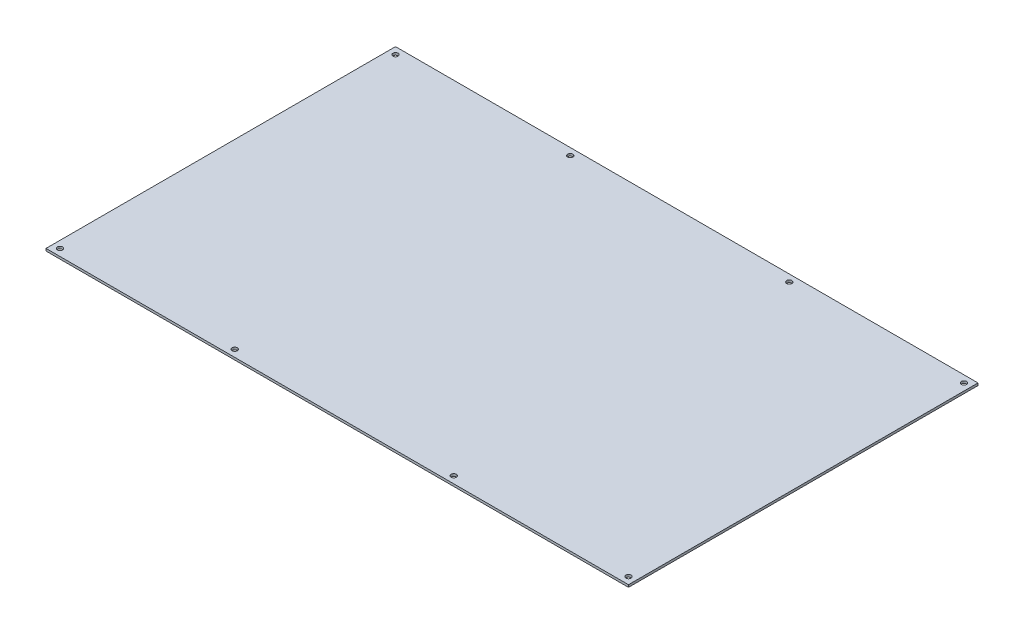
from build123d import *

# Parameters (mm, degrees)
SKETCH1_W            = 500
SKETCH1_H            = 300
BASE_FLANGE1_DEPTH   = 2
M4_CLEARANCE_HOLE1_D = 4.5


# Sheet-metal steps are written as plain solids
with BuildPart() as part:
    # Sketch1 → Base-Flange1 (new body)
    with BuildSketch(Plane(origin=(0, 0, 0), x_dir=(1, 0, 0), z_dir=(0, 1, 0))):
        Rectangle(SKETCH1_W, SKETCH1_H)
    extrude(amount=-BASE_FLANGE1_DEPTH)

    # M4 Clearance Hole1 (through all)
    with Locations(Plane(origin=(0, 0, 0), x_dir=(1, 0, 0), z_dir=(0, 1, 0))):
        with Locations((244, 144), (94, 144), (-94, 144), (-244, 144), (-244, -144), (-94, -144), (94, -144), (244, -144)):
            Hole(M4_CLEARANCE_HOLE1_D / 2)


solid = part.part
